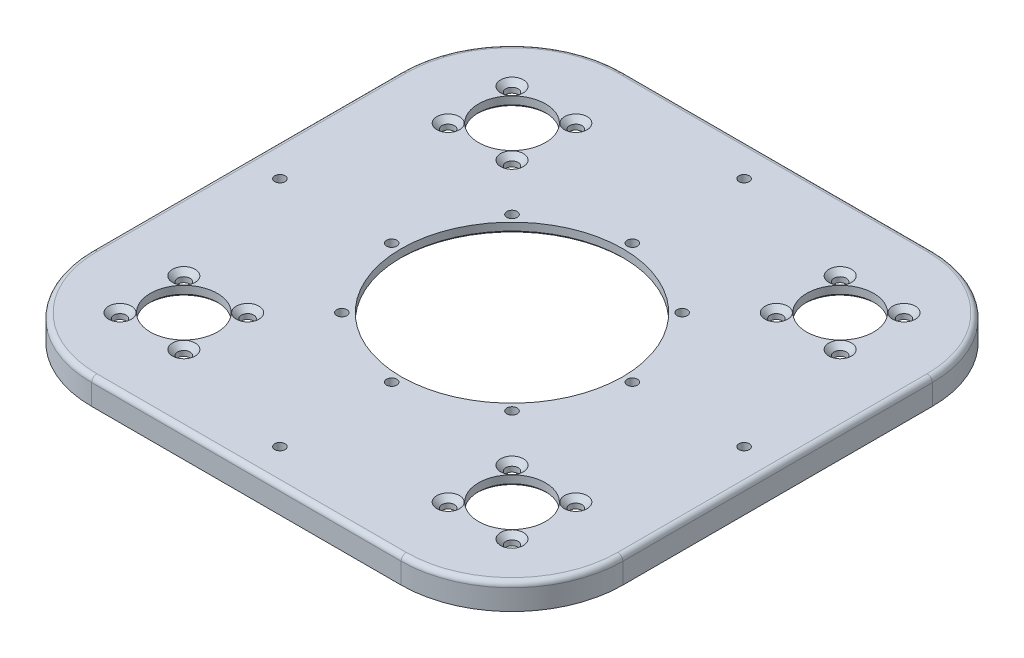
from build123d import *

# Parameters (mm, degrees)
SKETCH_1_W          = 200
SKETCH_1_H          = 200
SKETCH_1_R          = 2
SKETCH_1_R_2        = 43
EXTRUDE_1_DEPTH     = 4
FILLET_1_R          = 40
SKETCH_2_R          = 13
SKETCH_2_R_2        = 2.4
CUT_EXTRUDE_1_DEPTH = 6
CHAMFER_3_SIZE      = 2
EXTRUDE_1_2_DEPTH   = 10
FILLET_3_R          = 2
CHAMFER_5_SIZE      = 1


with BuildPart() as part:
    # Эскиз1 → Extrude 1 (new body)
    with BuildSketch(Plane(origin=(0, 0, 0), x_dir=(1, 0, 0), z_dir=(0, 1, 0))):
        Rectangle(SKETCH_1_W, SKETCH_1_H)
        with Locations((0, 90)):
            Circle(SKETCH_1_R, mode=Mode.SUBTRACT)
        with Locations((90, 0)):
            Circle(SKETCH_1_R, mode=Mode.SUBTRACT)
        with Locations((0, -90)):
            Circle(SKETCH_1_R, mode=Mode.SUBTRACT)
        with Locations((-90, 0)):
            Circle(SKETCH_1_R, mode=Mode.SUBTRACT)
        with Locations((0, 46.66904756)):
            Circle(SKETCH_1_R, mode=Mode.SUBTRACT)
        with Locations((33.000000001, 33.000000001)):
            Circle(SKETCH_1_R, mode=Mode.SUBTRACT)
        with Locations((46.66904756, 0)):
            Circle(SKETCH_1_R, mode=Mode.SUBTRACT)
        with Locations((33.000000001, -33.000000001)):
            Circle(SKETCH_1_R, mode=Mode.SUBTRACT)
        with Locations((0, -46.66904756)):
            Circle(SKETCH_1_R, mode=Mode.SUBTRACT)
        with Locations((-33.000000001, -33.000000001)):
            Circle(SKETCH_1_R, mode=Mode.SUBTRACT)
        with Locations((-46.66904756, 0)):
            Circle(SKETCH_1_R, mode=Mode.SUBTRACT)
        with Locations((-33.000000001, 33.000000001)):
            Circle(SKETCH_1_R, mode=Mode.SUBTRACT)
        Circle(SKETCH_1_R_2, mode=Mode.SUBTRACT)
    extrude(amount=EXTRUDE_1_DEPTH)

    # Скругление1
    fillet_1_edges = [part.edges().sort_by_distance(p)[0] for p in [
        (100, 2, -100),
        (-100, 2, -100),
        (-100, 2, 100),
        (100, 2, 100),
    ]]
    fillet(fillet_1_edges, radius=FILLET_1_R)

    # Эскиз2 → Вырез-Вытянуть1 (cut)
    with BuildSketch(Plane(origin=(0, 4, 0), x_dir=(1, 0, 0), z_dir=(0, 1, 0))):
        with Locations((63.639610307, 63.639610307)):
            Circle(SKETCH_2_R)
        with Locations((51.265241636, 76.013978978)):
            Circle(SKETCH_2_R_2)
        with Locations((76.013978978, 76.013978978)):
            Circle(SKETCH_2_R_2)
        with Locations((76.013978978, 51.265241636)):
            Circle(SKETCH_2_R_2)
        with Locations((51.265241636, 51.265241636)):
            Circle(SKETCH_2_R_2)
        with Locations((63.639610307, -63.639610307)):
            Circle(SKETCH_2_R)
        with Locations((76.013978978, -51.265241636)):
            Circle(SKETCH_2_R_2)
        with Locations((51.265241636, -51.265241636)):
            Circle(SKETCH_2_R_2)
        with Locations((51.265241636, -76.013978978)):
            Circle(SKETCH_2_R_2)
        with Locations((76.013978978, -76.013978978)):
            Circle(SKETCH_2_R_2)
        with Locations((-76.013978978, -76.013978978)):
            Circle(SKETCH_2_R_2)
        with Locations((-51.265241636, -76.013978978)):
            Circle(SKETCH_2_R_2)
        with Locations((-51.265241636, -51.265241636)):
            Circle(SKETCH_2_R_2)
        with Locations((-76.013978978, -51.265241636)):
            Circle(SKETCH_2_R_2)
        with Locations((-63.639610307, -63.639610307)):
            Circle(SKETCH_2_R)
        with Locations((-63.639610307, 63.639610307)):
            Circle(SKETCH_2_R)
        with Locations((-76.013978978, 51.265241636)):
            Circle(SKETCH_2_R_2)
        with Locations((-51.265241636, 51.265241636)):
            Circle(SKETCH_2_R_2)
        with Locations((-51.265241636, 76.013978978)):
            Circle(SKETCH_2_R_2)
        with Locations((-76.013978978, 76.013978978)):
            Circle(SKETCH_2_R_2)
    extrude(amount=-CUT_EXTRUDE_1_DEPTH, mode=Mode.SUBTRACT)

    # Фаска3
    chamfer_3_edges = [part.edges().sort_by_distance(p)[0] for p in [
        (-78.413978978, 4, -51.265241636),
        (73.613978978, 4, 76.013978978),
        (48.865241636, 4, 76.013978978),
        (48.865241636, 4, 51.265241636),
        (73.613978978, 4, 51.265241636),
        (-78.413978978, 4, 76.013978978),
        (-53.665241636, 4, 76.013978978),
        (-78.413978978, 4, 51.265241636),
        (-53.665241636, 4, 51.265241636),
        (-53.665241636, 4, -51.265241636),
        (-78.413978978, 4, -76.013978978),
        (-53.665241636, 4, -76.013978978),
        (48.865241636, 4, -51.265241636),
        (73.613978978, 4, -51.265241636),
        (73.613978978, 4, -76.013978978),
        (48.865241636, 4, -76.013978978),
    ]]
    chamfer(chamfer_3_edges, length=CHAMFER_3_SIZE)

    # Эскиз4 → Extrude 1 2 (add)
    with BuildSketch(Plane.XZ.offset(-4)):
        with BuildLine():
            Line((103, 60), (103, -60))
            ThreePointArc((103, -60), (90.405591591, -90.405591591), (60, -103))
            Line((60, -103), (-60, -103))
            ThreePointArc((-60, -103), (-90.405591591, -90.405591591), (-103, -60))
            Line((-103, -60), (-103, 60))
            ThreePointArc((-103, 60), (-90.405591591, 90.405591591), (-60, 103))
            Line((-60, 103), (60, 103))
            ThreePointArc((60, 103), (90.405591591, 90.405591591), (103, 60))
        make_face()
        with BuildLine():
            Line((100, 60), (100, -60))
            ThreePointArc((100, -60), (88.284271247, -88.284271247), (60, -100))
            Line((60, -100), (-60, -100))
            ThreePointArc((-60, -100), (-88.284271247, -88.284271247), (-100, -60))
            Line((-100, -60), (-100, 60))
            ThreePointArc((-100, 60), (-88.284271247, 88.284271247), (-60, 100))
            Line((-60, 100), (60, 100))
            ThreePointArc((60, 100), (88.284271247, 88.284271247), (100, 60))
        make_face(mode=Mode.SUBTRACT)
    extrude(amount=EXTRUDE_1_2_DEPTH)

    # Скругление3
    fillet_3_edges = [part.edges().sort_by_distance(p)[0] for p in [
        (90.405591591, 4, -90.405591591),
        (0, 4, -103),
        (-90.405591591, 4, -90.405591591),
        (-103, 4, 0),
        (-90.405591591, 4, 90.405591591),
        (0, 4, 103),
        (90.405591591, 4, 90.405591591),
        (103, 4, 0),
    ]]
    fillet(fillet_3_edges, radius=FILLET_3_R)

    # Фаска5
    chamfer_5_edges = [part.edges().sort_by_distance(p)[0] for p in [
        (-43, 0, 0),
        (50.639610307, 0, 63.639610307),
        (-76.639610307, 0, 63.639610307),
        (-76.639610307, 0, -63.639610307),
        (50.639610307, 0, -63.639610307),
    ]]
    chamfer(chamfer_5_edges, length=CHAMFER_5_SIZE)


solid = part.part
